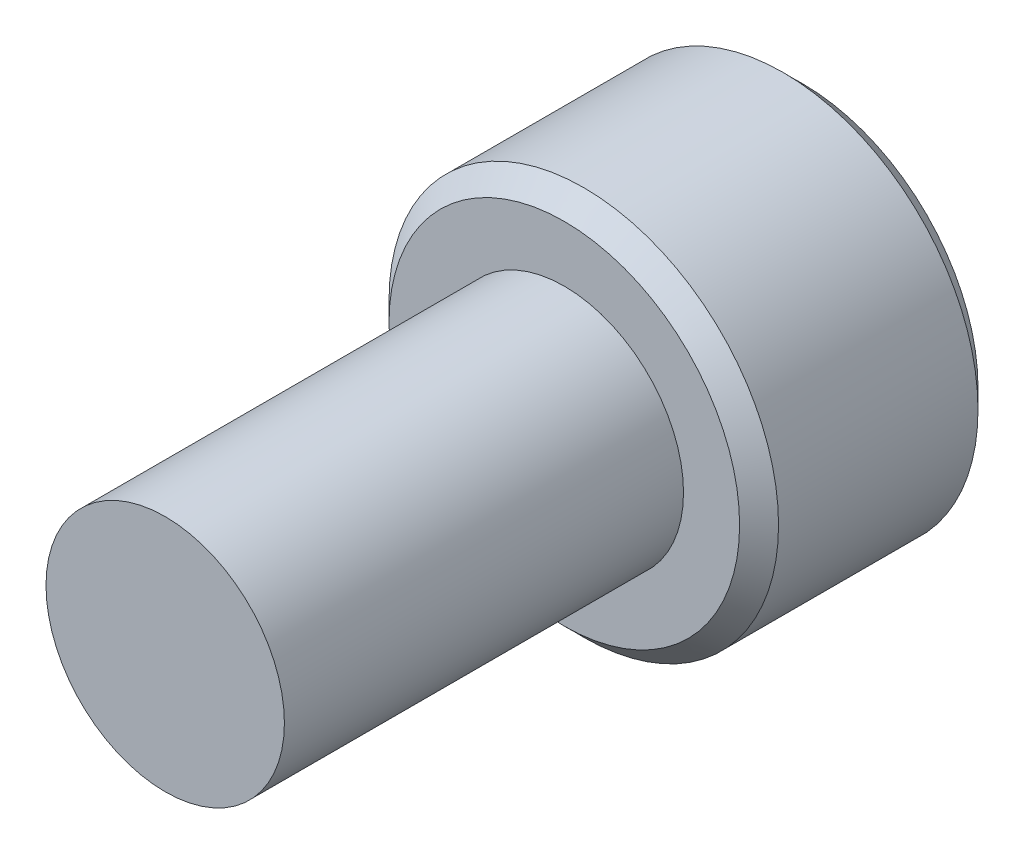
from build123d import *

# Parameters (mm, degrees)
SKETCH1_R          = 1.4224
EXTRUDE1_DEPTH     = 4.7625
SKETCH6_R          = 2.3241
EXTRUDE2_DEPTH     = 2.8448
CUT_EXTRUDE1_DEPTH = 1.7859375
CHAMFER1_SIZE      = 0.23241


with BuildPart() as part:
    # Sketch1 → Extrude1 (new body)
    with BuildSketch(Plane.XY):
        Circle(SKETCH1_R)
    extrude(amount=-EXTRUDE1_DEPTH)

    # Sketch6 → Extrude2 (add)
    with BuildSketch(Plane(origin=(0, 0, -4.7625), x_dir=(-1, 0, 0), z_dir=(0, 0, -1))):
        Circle(SKETCH6_R)
    extrude(amount=EXTRUDE2_DEPTH)

    # Sketch7 → Cut-Extrude1 (cut)
    with BuildSketch(Plane(origin=(0, 0, -7.6073), x_dir=(-1, 0, 0), z_dir=(0, 0, -1))):
        Polygon((0, 1.374815329), (-1.190625, 0.687407664), (-1.190625, -0.687407664), (0, -1.374815329), (1.190625, -0.687407664), (1.190625, 0.687407664), align=None)
    extrude(amount=-CUT_EXTRUDE1_DEPTH, mode=Mode.SUBTRACT)

    # Cut-Extrude2 cone 1 section (through the dimple's axis) → Cut-Extrude2 (revolve, cut)
    with BuildSketch(Plane(origin=(0, 0, -7.6073), x_dir=(0, 1, 0), z_dir=(1, 0, 0))):
        Polygon((0, 0), (1.374815329, 0), (0, 1.374815329), align=None)
    revolve(axis=Axis((0, 0, -7.6073), (0, 0, 1)), mode=Mode.SUBTRACT)

    # Chamfer1
    chamfer1_edges = [part.edges().sort_by_distance(p)[0] for p in [
        (2.3241, 0, -7.6073),
        (2.3241, 0, -4.7625),
    ]]
    chamfer(chamfer1_edges, length=CHAMFER1_SIZE)


solid = part.part
